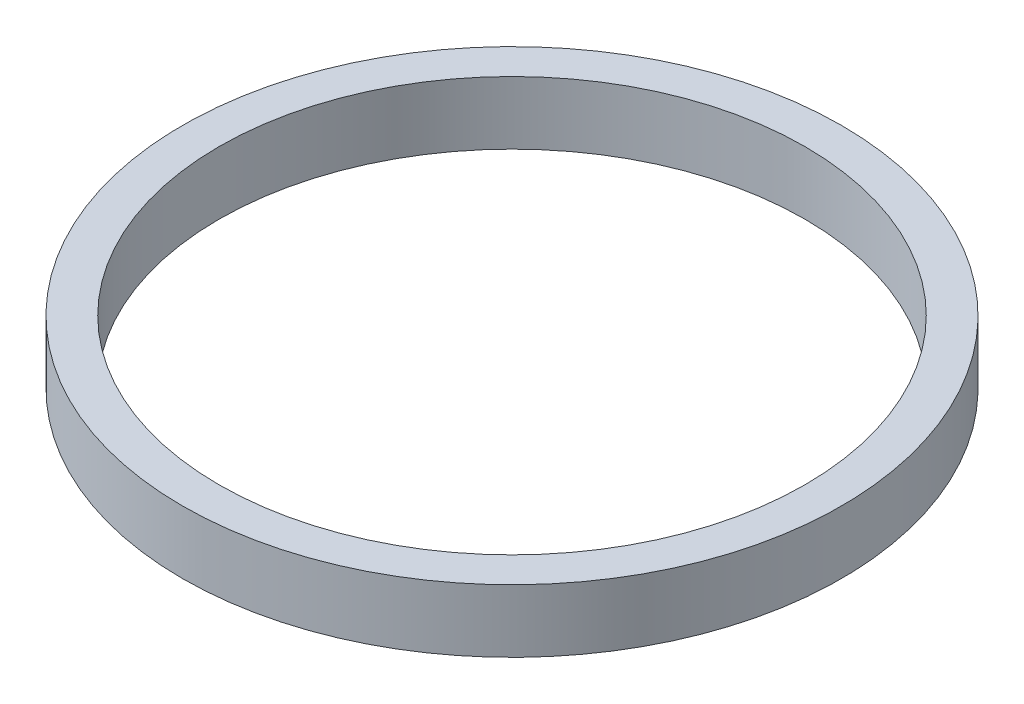
from build123d import *

# Parameters (mm, degrees)
SKETCH1_W = 7.5
SKETCH1_H = 12.885


with BuildPart() as part:
    # Sketch1 → Revolve1 (revolve)
    with BuildSketch(Plane.XY):
        with Locations((-63.75, 7.2275)):
            Rectangle(SKETCH1_W, SKETCH1_H)
    revolve(axis=Axis((0, -200069.047495165, 0), (0, 1, 0)))


solid = part.part
